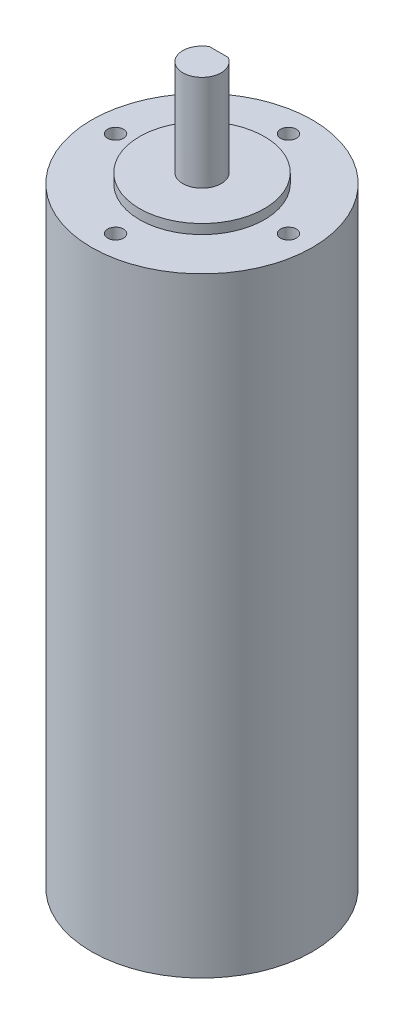
from build123d import *

# Parameters (mm, degrees)
SKETCH2_R           = 23
BOSS_EXTRUDE1_DEPTH = 127
SKETCH3_R           = 13
BOSS_EXTRUDE2_DEPTH = 2
SKETCH4_R           = 4
BOSS_EXTRUDE3_DEPTH = 20
SKETCH8_R           = 1.65
CUT_EXTRUDE1_DEPTH  = 10
CUT_EXTRUDE2_START  = -15
CUT_EXTRUDE2_DEPTH  = 15


with BuildPart() as part:
    # Sketch2 → Boss-Extrude1 (new body)
    with BuildSketch(Plane(origin=(0, 0, 0), x_dir=(1, 0, 0), z_dir=(0, 1, 0))):
        Circle(SKETCH2_R)
    extrude(amount=BOSS_EXTRUDE1_DEPTH)

    # Sketch3 → Boss-Extrude2 (add)
    with BuildSketch(Plane(origin=(0, 127, 0), x_dir=(1, 0, 0), z_dir=(0, 1, 0))):
        Circle(SKETCH3_R)
    extrude(amount=BOSS_EXTRUDE2_DEPTH)

    # Sketch4 → Boss-Extrude3 (add)
    with BuildSketch(Plane(origin=(0, 129, 0), x_dir=(1, 0, 0), z_dir=(0, 1, 0))):
        Circle(SKETCH4_R)
    extrude(amount=BOSS_EXTRUDE3_DEPTH)

    # Sketch8 → Cut-Extrude1 (cut)
    with BuildSketch(Plane(origin=(0, 127, 0), x_dir=(1, 0, 0), z_dir=(0, 1, 0))):
        with Locations((0, 18)):
            Circle(SKETCH8_R)
        with Locations((18, 0)):
            Circle(SKETCH8_R)
        with Locations((0, -18)):
            Circle(SKETCH8_R)
        with Locations((-18, 0)):
            Circle(SKETCH8_R)
    extrude(amount=-CUT_EXTRUDE1_DEPTH, mode=Mode.SUBTRACT)

    # Sketch10 → Cut-Extrude2 (cut)
    with BuildSketch(Plane(origin=(0, 149, 0), x_dir=(1, 0, 0), z_dir=(0, 1, 0)).offset(CUT_EXTRUDE2_START)):
        with BuildLine():
            ThreePointArc((1.936491673, 3.5), (0, 4), (-1.936491673, 3.5))
            Line((-1.936491673, 3.5), (1.936491673, 3.5))
        make_face()
    extrude(amount=CUT_EXTRUDE2_DEPTH, mode=Mode.SUBTRACT)


solid = part.part
